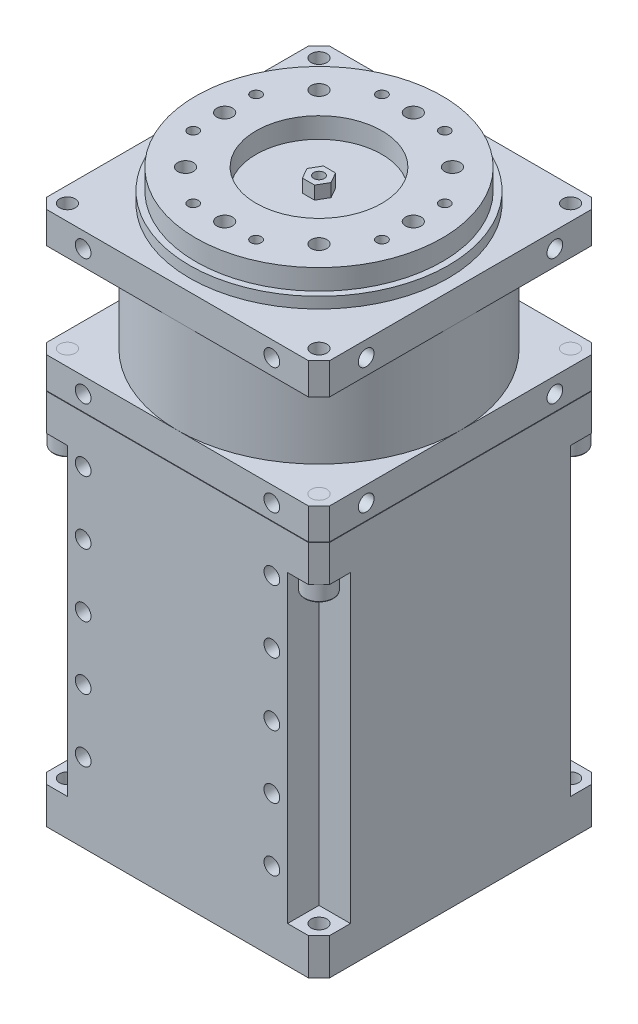
from build123d import *

# Parameters (mm, degrees)
SKETCH1_W                = 54
SKETCH1_H                = 54
BOSS_EXTRUDE1_DEPTH      = 78
SKETCH2_R                = 27
BOSS_EXTRUDE2_DEPTH      = 18
SKETCH3_W                = 54
SKETCH3_H                = 54
BOSS_EXTRUDE3_DEPTH      = 6
SKETCH4_R                = 24.7
BOSS_EXTRUDE4_DEPTH      = 2.1
SKETCH5_R                = 23.5
SKETCH5_R_2              = 12
BOSS_EXTRUDE5_DEPTH      = 6
CHAMFER1_SIZE            = 2
CUT_EXTRUDE1_START       = 7
SKETCH6_W                = 6
SKETCH6_H                = 6
CUT_EXTRUDE1_DEPTH       = 58
SKETCH7_R                = 1.5
CUT_EXTRUDE2_DEPTH       = 6.5
SKETCH10_R               = 1.5
CUT_EXTRUDE3_DEPTH       = 6.5
SKETCH11_R               = 1.5
CUT_EXTRUDE4_DEPTH       = 109.912809164
SKETCH12_R               = 1.5
SKETCH12_R_2             = 1
CUT_EXTRUDE5_DEPTH       = 7
SKETCH13_R               = 1
BOSS_EXTRUDE6_DEPTH      = 2.5
SKETCH14_R               = 2.75
BOSS_EXTRUDE7_DEPTH      = 3
CUT_EXTRUDE6_START       = -1.3000001
CUT_EXTRUDE6_DEPTH       = 2.3000001
FILLET1_R                = 0.15
CIRPATTERN3_COUNT        = 4
FILLET1_OF_CIRPATTERN3_R = 0.15
SKETCH17_R               = 1.5
BOSS_EXTRUDE8_DEPTH      = 13
BOSS_EXTRUDE8_2_DEPTH    = 13
BOSS_EXTRUDE8_3_DEPTH    = 13
BOSS_EXTRUDE8_4_DEPTH    = 13


with BuildPart() as part:
    # Sketch1 → Boss-Extrude1 (new body)
    with BuildSketch(Plane(origin=(0, 0, 0), x_dir=(1, 0, 0), z_dir=(0, 1, 0))):
        Rectangle(SKETCH1_W, SKETCH1_H)
    extrude(amount=BOSS_EXTRUDE1_DEPTH)

    # Sketch2 → Boss-Extrude2 (add)
    with BuildSketch(Plane(origin=(0, 78, 0), x_dir=(1, 0, 0), z_dir=(0, 1, 0))):
        with Locations(Location((0, 0, 0), (0, 0, 270))):
            Circle(SKETCH2_R)
    extrude(amount=BOSS_EXTRUDE2_DEPTH)

    # Sketch3 → Boss-Extrude3 (add)
    with BuildSketch(Plane(origin=(0, 96, 0), x_dir=(1, 0, 0), z_dir=(0, 1, 0))):
        Rectangle(SKETCH3_W, SKETCH3_H)
    extrude(amount=BOSS_EXTRUDE3_DEPTH)

    # Sketch4 → Boss-Extrude4 (add)
    with BuildSketch(Plane(origin=(0, 102, 0), x_dir=(1, 0, 0), z_dir=(0, 1, 0))):
        with Locations(Location((0, 0, 0), (0, 0, 90))):
            Circle(SKETCH4_R)
    extrude(amount=BOSS_EXTRUDE4_DEPTH)

    # Sketch5 → Boss-Extrude5 (add)
    with BuildSketch(Plane(origin=(0, 102, 0), x_dir=(1, 0, 0), z_dir=(0, 1, 0))):
        with Locations(Location((0, 0, 0), (0, 0, 270))):
            Circle(SKETCH5_R)
        with Locations(Location((0, 0, 0), (0, 0, 270))):
            Circle(SKETCH5_R_2, mode=Mode.SUBTRACT)
    extrude(amount=BOSS_EXTRUDE5_DEPTH)

    # Chamfer1
    chamfer1_edges = [part.edges().sort_by_distance(p)[0] for p in [
        (-27, 99, -27),
        (-27, 99, 27),
        (27, 99, 27),
        (27, 99, -27),
        (-27, 39, -27),
        (27, 39, -27),
        (27, 39, 27),
        (-27, 39, 27),
    ]]
    chamfer(chamfer1_edges, length=CHAMFER1_SIZE)

    # Sketch6 → Cut-Extrude1 (cut)
    with BuildSketch(Plane(origin=(0, 0, 0), x_dir=(1, 0, 0), z_dir=(0, 1, 0)).offset(CUT_EXTRUDE1_START)):
        with Locations((-24, 24)):
            Rectangle(SKETCH6_W, SKETCH6_H)
        with Locations((24, 24)):
            Rectangle(SKETCH6_W, SKETCH6_H)
        with Locations((24, -24)):
            Rectangle(SKETCH6_W, SKETCH6_H)
        with Locations((-24, -24)):
            Rectangle(SKETCH6_W, SKETCH6_H)
    extrude(amount=CUT_EXTRUDE1_DEPTH, mode=Mode.SUBTRACT)

    # Sketch7 → Cut-Extrude2 (cut)
    with BuildSketch(Plane.XY.offset(27)):
        with Locations((-18, 99)):
            Circle(SKETCH7_R)
        with Locations((18, 99)):
            Circle(SKETCH7_R)
        with Locations((-18, 75)):
            Circle(SKETCH7_R)
        with Locations((18, 75)):
            Circle(SKETCH7_R)
        with Locations((-18, 63)):
            Circle(SKETCH7_R)
        with Locations((18, 63)):
            Circle(SKETCH7_R)
        with Locations((-18, 51)):
            Circle(SKETCH7_R)
        with Locations((18, 51)):
            Circle(SKETCH7_R)
        with Locations((-18, 39)):
            Circle(SKETCH7_R)
        with Locations((18, 39)):
            Circle(SKETCH7_R)
        with Locations((-18, 27)):
            Circle(SKETCH7_R)
        with Locations((18, 27)):
            Circle(SKETCH7_R)
        with Locations((-18, 15)):
            Circle(SKETCH7_R)
        with Locations((18, 15)):
            Circle(SKETCH7_R)
    cut_extrude2 = extrude(amount=-CUT_EXTRUDE2_DEPTH, mode=Mode.SUBTRACT)

    # Mirror1: Cut-Extrude2 across plane
    add(cut_extrude2.mirror(Plane.XY), mode=Mode.SUBTRACT)

    # Cut-Sweep1: sweep along a path in Sketch8
    with BuildLine(Plane(origin=(0, 72, 0), x_dir=(1, 0, 0), z_dir=(0, 1, 0))) as cut_sweep1_path:
        Line((25, 27), (-25, 27))
        Line((-25, 27), (-27, 25))
        Line((-27, 25), (-27, -25))
        Line((-27, -25), (-25, -27))
        Line((-25, -27), (25, -27))
        Line((25, -27), (27, -25))
        Line((27, -25), (27, 25))
        Line((27, 25), (25, 27))
    # Sketch9 → Cut-Sweep1 (sweep, cut)
    with BuildSketch(Plane.XY):
        Polygon((-27, 72.05), (-26.9, 72), (-27, 71.95), align=None)
    sweep(path=cut_sweep1_path.line, transition=Transition.RIGHT, mode=Mode.SUBTRACT)

    # Sketch10 → Cut-Extrude3 (cut)
    with BuildSketch(Plane.ZY.offset(27)):
        with Locations((-18, 99)):
            Circle(SKETCH10_R)
        with Locations((18, 99)):
            Circle(SKETCH10_R)
        with Locations((-18, 75)):
            Circle(SKETCH10_R)
        with Locations((18, 75)):
            Circle(SKETCH10_R)
    cut_extrude3 = extrude(amount=-CUT_EXTRUDE3_DEPTH, mode=Mode.SUBTRACT)

    # Mirror2: Cut-Extrude3 across plane
    add(cut_extrude3.mirror(Plane(origin=(0, 0, 0), x_dir=(0, 0, 1), z_dir=(1, 0, 0))), mode=Mode.SUBTRACT)

    # Sketch11 → Cut-Extrude4 (cut, through all)
    with BuildSketch(Plane(origin=(0, 102, 0), x_dir=(1, 0, 0), z_dir=(0, 1, 0))):
        with Locations(Location((-24, 24, 0), (0, 0, 270))):
            Circle(SKETCH11_R)
        with Locations(Location((24, 24, 0), (0, 0, 270))):
            Circle(SKETCH11_R)
        with Locations(Location((24, -24, 0), (0, 0, 90))):
            Circle(SKETCH11_R)
        with Locations(Location((-24, -24, 0), (0, 0, 270))):
            Circle(SKETCH11_R)
    extrude(amount=-CUT_EXTRUDE4_DEPTH, mode=Mode.SUBTRACT)

    # Sketch12 → Cut-Extrude5 (cut)
    with BuildSketch(Plane(origin=(0, 108, 0), x_dir=(1, 0, 0), z_dir=(0, 1, 0))):
        with Locations(Location((0, 18, 0), (0, 0, 270))):
            Circle(SKETCH12_R)
        with Locations(Location((12.727922061, 12.727922061, 0), (0, 0, 270))):
            Circle(SKETCH12_R)
        with Locations(Location((18, 0, 0), (0, 0, 270))):
            Circle(SKETCH12_R)
        with Locations(Location((12.727922061, -12.727922061, 0), (0, 0, 270))):
            Circle(SKETCH12_R)
        with Locations(Location((0, -18, 0), (0, 0, 270))):
            Circle(SKETCH12_R)
        with Locations(Location((-12.727922061, -12.727922061, 0), (0, 0, 270))):
            Circle(SKETCH12_R)
        with Locations(Location((-18, 0, 0), (0, 0, 270))):
            Circle(SKETCH12_R)
        with Locations(Location((-12.727922061, 12.727922061, 0), (0, 0, 270))):
            Circle(SKETCH12_R)
        with Locations(Location((-6, 18, 0), (0, 0, 270))):
            Circle(SKETCH12_R_2)
        with Locations(Location((6, 18, 0), (0, 0, 90))):
            Circle(SKETCH12_R_2)
        with Locations(Location((18, 6, 0), (0, 0, 270))):
            Circle(SKETCH12_R_2)
        with Locations(Location((18, -6, 0), (0, 0, 90))):
            Circle(SKETCH12_R_2)
        with Locations(Location((6, -18, 0), (0, 0, 270))):
            Circle(SKETCH12_R_2)
        with Locations(Location((-6, -18, 0), (0, 0, 90))):
            Circle(SKETCH12_R_2)
        with Locations(Location((-18, -6, 0), (0, 0, 270))):
            Circle(SKETCH12_R_2)
        with Locations(Location((-18, 6, 0), (0, 0, 90))):
            Circle(SKETCH12_R_2)
    extrude(amount=-CUT_EXTRUDE5_DEPTH, mode=Mode.SUBTRACT)

    # Sketch13 → Boss-Extrude6 (add)
    with BuildSketch(Plane(origin=(0, 104.1, 0), x_dir=(1, 0, 0), z_dir=(0, 1, 0))):
        Polygon((2.309401077, 0), (1.154700538, 2), (-1.154700538, 2), (-2.309401077, 0), (-1.154700538, -2), (1.154700538, -2), align=None)
        with Locations(Location((0, 0, 0), (0, 0, 270))):
            Circle(SKETCH13_R, mode=Mode.SUBTRACT)
    extrude(amount=BOSS_EXTRUDE6_DEPTH)

    # Sketch14 → Boss-Extrude7 (add)
    with BuildSketch(Plane.XZ.offset(-65)):
        with Locations(Location((-24, 24, 0), (0, 0, 270))):
            Circle(SKETCH14_R)
    boss_extrude7 = extrude(amount=BOSS_EXTRUDE7_DEPTH)

    # Sketch15 → Cut-Revolve1 (revolve, cut)
    with BuildSketch(Plane.YZ.offset(-24), mode=Mode.PRIVATE) as cut_revolve1_sk:
        Polygon((62, 25.28), (63.3, 25.28), (64.039008345, 24), (62, 24), align=None)
    cut_revolve1 = revolve(cut_revolve1_sk.sketch.rotate(Axis((-24, -917.5, 24), (0, 1, 0)), 180), axis=Axis((-24, -917.5, 24), (0, 1, 0)), mode=Mode.SUBTRACT)

    # Cut-Extrude6: read off the stored shape, not the designer's step
    # Cut-Extrude6 outline → Cut-Extrude6 (cut)
    with BuildSketch(Plane.XZ.offset(-62).offset(CUT_EXTRUDE6_START)):
        with BuildLine():
            Line((-22.891487478, 23.360000009), (-22.521983311, 24))
            Line((-22.521983311, 24), (-22.891487478, 24.639999991))
            ThreePointArc((-22.891487478, 24.639999991), (-22.72, 24), (-22.891487478, 23.360000009))
        make_face()
        with BuildLine():
            ThreePointArc((-24, 25.28), (-23.359999996, 25.108512514), (-22.891487478, 24.639999991))
            Line((-22.891487478, 24.639999991), (-23.260991655, 25.28))
            Line((-23.260991655, 25.28), (-24, 25.28))
        make_face()
        with BuildLine():
            Line((-23.260991655, 22.72), (-22.891487478, 23.360000009))
            ThreePointArc((-22.891487478, 23.360000009), (-23.359999996, 22.891487486), (-24, 22.72))
            Line((-24, 22.72), (-23.260991655, 22.72))
        make_face()
        with BuildLine():
            ThreePointArc((-25.108512547, 24.639999948), (-24.640000026, 25.108512502), (-24, 25.28))
            Line((-24, 25.28), (-24.739008345, 25.28))
            Line((-24.739008345, 25.28), (-25.108512547, 24.639999948))
        make_face()
        with BuildLine():
            Line((-24.739008345, 22.72), (-24, 22.72))
            ThreePointArc((-24, 22.72), (-24.640000015, 22.891487492), (-25.108512535, 23.360000031))
            Line((-25.108512535, 23.360000031), (-24.739008345, 22.72))
        make_face()
        with BuildLine():
            ThreePointArc((-25.108512535, 23.360000031), (-25.28, 23.999999988), (-25.108512547, 24.639999948))
            Line((-25.108512547, 24.639999948), (-25.478016689, 24))
            Line((-25.478016689, 24), (-25.108512535, 23.360000031))
        make_face()
    cut_extrude6 = extrude(amount=CUT_EXTRUDE6_DEPTH, mode=Mode.SUBTRACT)

    # Cut-Extrude6 2 outline → Cut-Extrude6 2 (revolve)
    with BuildSketch(Plane(origin=(-24, 0, 24), x_dir=(1, 0, 0), z_dir=(0, 0, 1))):
        Polygon((1.478016689, 63.3000001), (1.28, 63.3000001), (1.478016702, 63.185675004), align=None)
    cut_extrude6_2 = revolve(axis=Axis((-24, 0, 24), (0, 1, 0)))

    # Fillet1
    fillet1_edges = [part.edges().sort_by_distance(p)[0] for p in [
        (-24, 62, 26.75),
    ]]
    fillet(fillet1_edges, radius=FILLET1_R)

    # CirPattern3: Boss-Extrude7, Cut-Revolve1, Cut-Extrude6, Cut-Extrude6 2 ×4 about axis
    cirpattern3_axis = Axis((0, 0, 0), (0, 1, 0))
    add([boss_extrude7.rotate(cirpattern3_axis, i * 360 / CIRPATTERN3_COUNT) for i in range(1, CIRPATTERN3_COUNT)])
    add([cut_revolve1.rotate(cirpattern3_axis, i * 360 / CIRPATTERN3_COUNT) for i in range(1, CIRPATTERN3_COUNT)], mode=Mode.SUBTRACT)
    add([cut_extrude6.rotate(cirpattern3_axis, i * 360 / CIRPATTERN3_COUNT) for i in range(1, CIRPATTERN3_COUNT)], mode=Mode.SUBTRACT)
    add([cut_extrude6_2.rotate(cirpattern3_axis, i * 360 / CIRPATTERN3_COUNT) for i in range(1, CIRPATTERN3_COUNT)])

    # Fillet1 of CirPattern3
    fillet1_of_cirpattern3_edges = [part.edges().sort_by_distance(p)[0] for p in [
        (26.75, 62, 24),
        (24, 62, -26.75),
        (-26.75, 62, -24),
    ]]
    fillet(fillet1_of_cirpattern3_edges, radius=FILLET1_OF_CIRPATTERN3_R)


with BuildPart() as body_2:
    # Sketch17 → Boss-Extrude8 (new body)
    with BuildSketch(Plane(origin=(0, 65, 0), x_dir=(1, 0, 0), z_dir=(0, 1, 0))):
        with Locations(Location((-24, -24, 0), (0, 0, 90))):
            Circle(SKETCH17_R)
    extrude(amount=BOSS_EXTRUDE8_DEPTH)


with BuildPart() as body_3:
    # Sketch17 → Boss-Extrude8 2 (new body)
    with BuildSketch(Plane(origin=(0, 65, 0), x_dir=(1, 0, 0), z_dir=(0, 1, 0))):
        with Locations(Location((-24, 24, 0), (0, 0, 90))):
            Circle(SKETCH17_R)
    extrude(amount=BOSS_EXTRUDE8_2_DEPTH)


with BuildPart() as body_4:
    # Sketch17 → Boss-Extrude8 3 (new body)
    with BuildSketch(Plane(origin=(0, 65, 0), x_dir=(1, 0, 0), z_dir=(0, 1, 0))):
        with Locations(Location((24, 24, 0), (0, 0, 90))):
            Circle(SKETCH17_R)
    extrude(amount=BOSS_EXTRUDE8_3_DEPTH)


with BuildPart() as body_5:
    # Sketch17 → Boss-Extrude8 4 (new body)
    with BuildSketch(Plane(origin=(0, 65, 0), x_dir=(1, 0, 0), z_dir=(0, 1, 0))):
        with Locations(Location((24, -24, 0), (0, 0, 90))):
            Circle(SKETCH17_R)
    extrude(amount=BOSS_EXTRUDE8_4_DEPTH)


solid = Compound([part.part, body_2.part, body_3.part, body_4.part, body_5.part])
